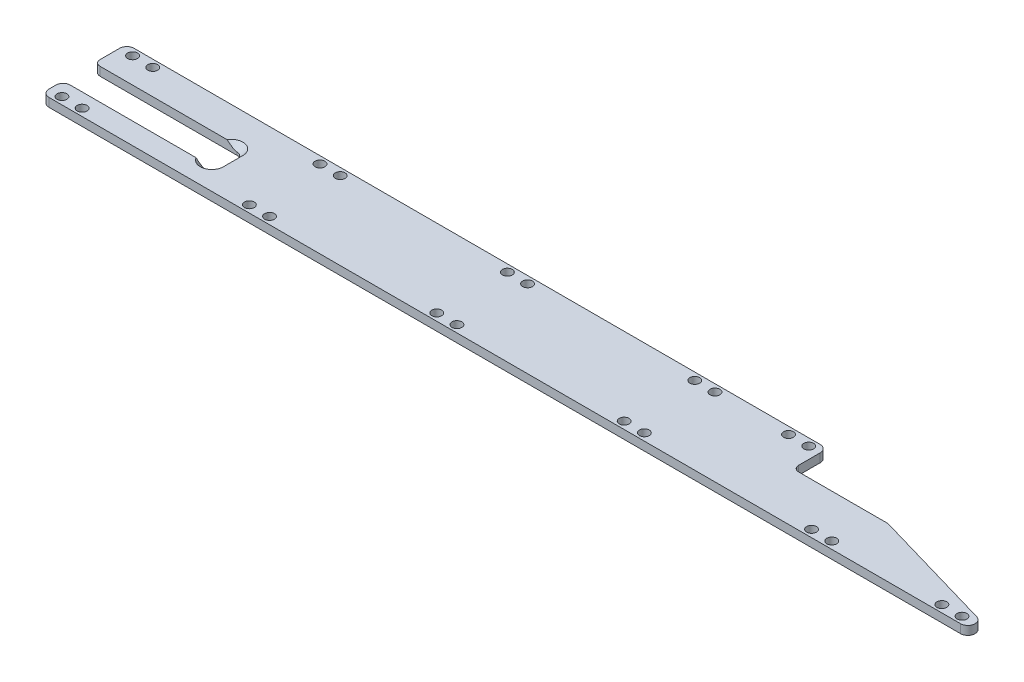
from build123d import *

# Parameters (mm, degrees)
BOSS_EXTRUDE1_DEPTH  = 3
M3_CLEARANCE_HOLE1_D = 3.4
CUT_EXTRUDE5_DEPTH   = 10
FILLET3_R            = 2
CHAMFER1_SIZE        = 2
SKETCH30_R           = 1.7
BOSS_EXTRUDE3_DEPTH  = 3
FILLET4_R            = 2.5


with BuildPart() as part:
    # Sketch1 → Boss-Extrude1 (new body)
    with BuildSketch(Plane(origin=(0, 0, 0), x_dir=(1, 0, 0), z_dir=(0, 1, 0))):
        with BuildLine():
            Line((-135.5, 14.75), (135.5, 14.75))
            ThreePointArc((135.5, 14.75), (137.267766953, 14.017766953), (138, 12.25))
            Line((138, 12.25), (138, -12.25))
            ThreePointArc((138, -12.25), (137.267766953, -14.017766953), (135.5, -14.75))
            Line((135.5, -14.75), (-135.5, -14.75))
            ThreePointArc((-135.5, -14.75), (-137.267766953, -14.017766953), (-138, -12.25))
            Line((-138, -12.25), (-138, 12.25))
            ThreePointArc((-138, 12.25), (-137.267766953, 14.017766953), (-135.5, 14.75))
        make_face()
    extrude(amount=BOSS_EXTRUDE1_DEPTH)

    # M3 Clearance Hole1 (through all)
    with Locations(Plane.XZ):
        with Locations((-133.5, 12.25), (-126.5, 12.25), (-133.5, -12.25), (-126.5, -12.25), (-68.5, 12.25), (-61.5, 12.25), (-68.5, -12.25), (-61.5, -12.25), (-3.5, 12.25), (3.5, 12.25), (-3.5, -12.25), (3.5, -12.25), (61.5, 12.25), (68.5, 12.25), (61.5, -12.25), (68.5, -12.25), (126.5, 12.25), (133.5, 12.25), (126.5, -12.25), (133.5, -12.25), (94, -12.25), (101, -12.25)):
            Hole(M3_CLEARANCE_HOLE1_D / 2)

    # Sketch29 → Cut-Extrude5 (cut)
    with BuildSketch(Plane.XZ):
        with BuildLine():
            Line((105, -14.75), (105, -4.75))
            ThreePointArc((105, -4.75), (105.585786438, -3.335786438), (107, -2.75))
            Line((107, -2.75), (138, -2.75))
            Line((138, -2.75), (138, -14.75))
            Line((138, -14.75), (105, -14.75))
        make_face()
        with BuildLine():
            Line((-86.41637679, 5.3456), (-86.41637679, -1.4522))
            ThreePointArc((-86.41637679, -1.4522), (-87.002163227, -2.866413562), (-88.41637679, -3.4522))
            Line((-88.41637679, -3.4522), (-138, -3.4522))
            Line((-138, -3.4522), (-138, 9.8456))
            ThreePointArc((-138, 9.8456), (-137.267766953, 8.077833047), (-135.5, 7.3456))
            Line((-135.5, 7.3456), (-88.41637679, 7.3456))
            ThreePointArc((-88.41637679, 7.3456), (-87.002163227, 6.759813562), (-86.41637679, 5.3456))
        make_face()
    extrude(amount=-CUT_EXTRUDE5_DEPTH, mode=Mode.SUBTRACT)

    # Fillet3
    fillet3_edges = [part.edges().sort_by_distance(p)[0] for p in [
        (-138, 1.5, -3.4522),
    ]]
    fillet(fillet3_edges, radius=FILLET3_R)

    # Chamfer1
    # the kernel refuses this chamfer: 2 mm, written as the material it takes off along each edge
    with BuildSketch(Plane(origin=(-88.41637679, 3, 5.3456), x_dir=(1, 0, 0), z_dir=(0, 0, -1))) as chamfer1_piece_1:
        Polygon((2, CHAMFER1_SIZE), (2 + CHAMFER1_SIZE, 0), (2, 0), align=None)
    revolve(axis=Axis((-88.41637679, 3, 5.3456), (0, -1, 0)), revolution_arc=237.405771779, mode=Mode.SUBTRACT)
    with BuildSketch(Plane(origin=(-86.41637679, 3, 5.3456), x_dir=(-0.027495876610589075, -0.9996219169112968, 0), z_dir=(0, 0, -1))) as chamfer1_piece_2:
        Polygon((CHAMFER1_SIZE * 0.999621916911, -CHAMFER1_SIZE * 0.0274958766106), (-CHAMFER1_SIZE * 0.0274958766106, -CHAMFER1_SIZE * 0.999621916911), (0, 0), align=None)
    extrude(amount=6.7978, mode=Mode.SUBTRACT)
    with BuildSketch(Plane(origin=(-88.41637679, 3, -1.4522), x_dir=(-0.5386859165215122, 0, 0.842506666645065), z_dir=(0.842506666645065, 0, 0.5386859165215122))) as chamfer1_piece_3:
        Polygon((2, CHAMFER1_SIZE), (2 + CHAMFER1_SIZE, 0), (2, 0), align=None)
    revolve(axis=Axis((-88.41637679, 3, -1.4522), (0, -1, 0)), revolution_arc=237.405771779, mode=Mode.SUBTRACT)

    # Sketch30 → Boss-Extrude3 (add)
    with BuildSketch(Plane.XZ):
        with BuildLine():
            Line((138, -2.75), (181.384803676, 9.849187775))
            ThreePointArc((181.384803676, 9.849187775), (183.162673325, 12.602114639), (180.687594482, 14.75))
            Line((180.687594482, 14.75), (135.5, 14.75))
            ThreePointArc((135.5, 14.75), (137.267766953, 14.017766953), (138, 12.25))
            Line((138, 12.25), (138, -2.75))
        make_face()
        with Locations(Location((171.687594482, 12.25, 0), (0, 0, 270))):
            Circle(SKETCH30_R, mode=Mode.SUBTRACT)
        with Locations(Location((178.687594482, 12.25, 0), (0, 0, 270))):
            Circle(SKETCH30_R, mode=Mode.SUBTRACT)
    extrude(amount=-BOSS_EXTRUDE3_DEPTH)

    # Fillet4
    fillet4_edges = [part.edges().sort_by_distance(p)[0] for p in [
        (105, 1.5, -14.75),
        (138, 1.5, -2.75),
    ]]
    fillet(fillet4_edges, radius=FILLET4_R)


solid = part.part
